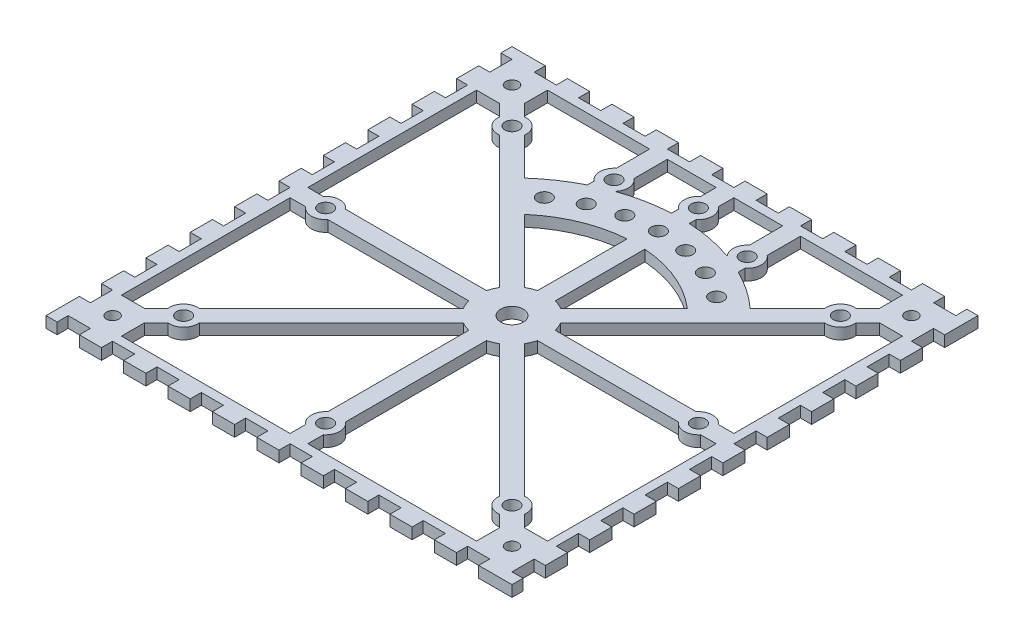
from build123d import *

# Parameters (mm, degrees)
SKETCH1_R           = 2.55
SKETCH1_R_2         = 1.6
SKETCH1_R_3         = 1.4
BOSS_EXTRUDE1_DEPTH = 2.5


with BuildPart() as part:
    # Sketch1 → Boss-Extrude1 (new body)
    with BuildSketch(Plane(origin=(0, 0, 0), x_dir=(1, 0, 0), z_dir=(0, 1, 0))):
        Polygon((-50, 52.5), (-45, 52.5), (-45, 50), (-40, 50), (-40, 52.5), (-35, 52.5), (-35, 50), (-30, 50), (-30, 52.5), (-25, 52.5), (-25, 50), (-20, 50), (-20, 52.5), (-15, 52.5), (-15, 50), (-10, 50), (-10, 52.5), (-5, 52.5), (-5, 50), (0, 50), (0, 52.5), (5, 52.5), (5, 50), (10, 50), (10, 52.5), (15, 52.5), (15, 50), (20, 50), (20, 52.5), (25, 52.5), (25, 50), (30, 50), (30, 52.5), (35, 52.5), (35, 50), (40, 50), (40, 52.5), (45, 52.5), (45, 50), (50, 50), (50, 52.5), (52.5, 52.5), (52.5, 50), (52.5, 45), (50, 45), (50, 40), (52.5, 40), (52.5, 35), (50, 35), (50, 30), (52.5, 30), (52.5, 25), (50, 25), (50, 20), (52.5, 20), (52.5, 15), (50, 15), (50, 10), (52.5, 10), (52.5, 5), (50, 5), (50, 0), (52.5, 0), (52.5, -5), (50, -5), (50, -10), (52.5, -10), (52.5, -15), (50, -15), (50, -20), (52.5, -20), (52.5, -25), (50, -25), (50, -30), (52.5, -30), (52.5, -35), (50, -35), (50, -40), (52.5, -40), (52.5, -45), (50, -45), (50, -50), (52.5, -50), (52.5, -52.5), (50, -52.5), (45, -52.5), (45, -50), (40, -50), (40, -52.5), (35, -52.5), (35, -50), (30, -50), (30, -52.5), (25, -52.5), (25, -50), (20, -50), (20, -52.5), (15, -52.5), (15, -50), (10, -50), (10, -52.5), (5, -52.5), (5, -50), (0, -50), (0, -52.5), (-5, -52.5), (-5, -50), (-10, -50), (-10, -52.5), (-15, -52.5), (-15, -50), (-20, -50), (-20, -52.5), (-25, -52.5), (-25, -50), (-30, -50), (-30, -52.5), (-35, -52.5), (-35, -50), (-40, -50), (-40, -52.5), (-45, -52.5), (-45, -50), (-50, -50), (-50, -52.5), (-52.5, -52.5), (-52.5, -50), (-52.5, -45), (-50, -45), (-50, -40), (-52.5, -40), (-52.5, -35), (-50, -35), (-50, -30), (-52.5, -30), (-52.5, -25), (-50, -25), (-50, -20), (-52.5, -20), (-52.5, -15), (-50, -15), (-50, -10), (-52.5, -10), (-52.5, -5), (-50, -5), (-50, 0), (-52.5, 0), (-52.5, 5), (-50, 5), (-50, 10), (-52.5, 10), (-52.5, 15), (-50, 15), (-50, 20), (-52.5, 20), (-52.5, 25), (-50, 25), (-50, 30), (-52.5, 30), (-52.5, 35), (-50, 35), (-50, 40), (-52.5, 40), (-52.5, 45), (-50, 45), (-50, 50), (-52.5, 50), (-52.5, 52.5), align=None)
        Circle(SKETCH1_R, mode=Mode.SUBTRACT)
        with Locations((37, -37)):
            Circle(SKETCH1_R_2, mode=Mode.SUBTRACT)
        with Locations((-37, -37)):
            Circle(SKETCH1_R_2, mode=Mode.SUBTRACT)
        with Locations((-37, 37)):
            Circle(SKETCH1_R_2, mode=Mode.SUBTRACT)
        with Locations((37, 37)):
            Circle(SKETCH1_R_2, mode=Mode.SUBTRACT)
        with Locations((0, 42)):
            Circle(SKETCH1_R_2, mode=Mode.SUBTRACT)
        with Locations((42, 0)):
            Circle(SKETCH1_R_2, mode=Mode.SUBTRACT)
        with Locations((-42, 0)):
            Circle(SKETCH1_R_2, mode=Mode.SUBTRACT)
        with Locations((0, -42)):
            Circle(SKETCH1_R_2, mode=Mode.SUBTRACT)
        with Locations((-45, 45)):
            Circle(SKETCH1_R_3, mode=Mode.SUBTRACT)
        with Locations((45, 45)):
            Circle(SKETCH1_R_3, mode=Mode.SUBTRACT)
        with Locations((-45, -45)):
            Circle(SKETCH1_R_3, mode=Mode.SUBTRACT)
        with Locations((45, -45)):
            Circle(SKETCH1_R_3, mode=Mode.SUBTRACT)
        with Locations((-15, 38)):
            Circle(SKETCH1_R_2, mode=Mode.SUBTRACT)
        with Locations((15, 38)):
            Circle(SKETCH1_R_2, mode=Mode.SUBTRACT)
        with Locations((0, 33)):
            Circle(SKETCH1_R_2, mode=Mode.SUBTRACT)
        with Locations((6.861085797, 32.278870824)):
            Circle(SKETCH1_R_2, mode=Mode.SUBTRACT)
        with Locations((13.422309222, 30.147000102)):
            Circle(SKETCH1_R_2, mode=Mode.SUBTRACT)
        with Locations((19.396913326, 26.697560814)):
            Circle(SKETCH1_R_2, mode=Mode.SUBTRACT)
        with Locations((-19.396913326, 26.697560814)):
            Circle(SKETCH1_R_2, mode=Mode.SUBTRACT)
        with Locations((-13.422309221, 30.147000102)):
            Circle(SKETCH1_R_2, mode=Mode.SUBTRACT)
        with Locations((-6.861085797, 32.278870824)):
            Circle(SKETCH1_R_2, mode=Mode.SUBTRACT)
        with BuildLine():
            Line((-40, 48), (-17, 48))
            Line((-17, 48), (-17, 40.497999199))
            ThreePointArc((-17, 40.497999199), (-18.2, 38), (-17, 35.502000801))
            Line((-17, 35.502000801), (-17, 33.985290936))
            ThreePointArc((-17, 33.985290936), (-21.402484999, 31.399580186), (-25.418602168, 28.247029292))
            Line((-25.418602168, 28.247029292), (-33.819434264, 36.647861389))
            ThreePointArc((-33.819434264, 36.647861389), (-34.7372583, 39.2627417), (-37.352138611, 40.180565736))
            Line((-37.352138611, 40.180565736), (-40, 42.828427125))
            Line((-40, 42.828427125), (-40, 48))
        make_face(mode=Mode.SUBTRACT)
        with BuildLine():
            Line((-48, 40), (-48, 2))
            Line((-48, 2), (-44.497999199, 2))
            ThreePointArc((-44.497999199, 2), (-42, 3.2), (-39.502000801, 2))
            Line((-39.502000801, 2), (-7.745966692, 2))
            ThreePointArc((-7.745966692, 2), (-7.39103626, 3.061467459), (-6.891439137, 4.063012013))
            Line((-6.891439137, 4.063012013), (-36.647861389, 33.819434264))
            ThreePointArc((-36.647861389, 33.819434264), (-39.2627417, 34.7372583), (-40.180565736, 37.352138611))
            Line((-40.180565736, 37.352138611), (-42.828427125, 40))
            Line((-42.828427125, 40), (-48, 40))
        make_face(mode=Mode.SUBTRACT)
        with BuildLine():
            Line((-40, -48), (-2, -48))
            Line((-2, -48), (-2, -44.497999199))
            ThreePointArc((-2, -44.497999199), (-3.2, -42), (-2, -39.502000801))
            Line((-2, -39.502000801), (-2, -7.745966692))
            ThreePointArc((-2, -7.745966692), (-3.061467459, -7.39103626), (-4.063012013, -6.891439137))
            Line((-4.063012013, -6.891439137), (-33.819434264, -36.647861389))
            ThreePointArc((-33.819434264, -36.647861389), (-34.7372583, -39.2627417), (-37.352138611, -40.180565736))
            Line((-37.352138611, -40.180565736), (-40, -42.828427125))
            Line((-40, -42.828427125), (-40, -48))
        make_face(mode=Mode.SUBTRACT)
        with BuildLine():
            Line((48, 40), (48, 2))
            Line((48, 2), (44.497999199, 2))
            ThreePointArc((44.497999199, 2), (42, 3.2), (39.502000801, 2))
            Line((39.502000801, 2), (7.745966692, 2))
            ThreePointArc((7.745966692, 2), (7.39103626, 3.061467459), (6.891439137, 4.063012013))
            Line((6.891439137, 4.063012013), (36.647861389, 33.819434264))
            ThreePointArc((36.647861389, 33.819434264), (39.2627417, 34.7372583), (40.180565736, 37.352138611))
            Line((40.180565736, 37.352138611), (42.828427125, 40))
            Line((42.828427125, 40), (48, 40))
        make_face(mode=Mode.SUBTRACT)
        with BuildLine():
            Line((48, -2), (48, -40))
            Line((48, -40), (42.828427125, -40))
            Line((42.828427125, -40), (40.180565736, -37.352138611))
            ThreePointArc((40.180565736, -37.352138611), (39.2627417, -34.7372583), (36.647861389, -33.819434264))
            Line((36.647861389, -33.819434264), (6.891439137, -4.063012013))
            ThreePointArc((6.891439137, -4.063012013), (7.39103626, -3.061467459), (7.745966692, -2))
            Line((7.745966692, -2), (39.502000801, -2))
            ThreePointArc((39.502000801, -2), (42, -3.2), (44.497999199, -2))
            Line((44.497999199, -2), (48, -2))
        make_face(mode=Mode.SUBTRACT)
        with BuildLine():
            Line((40, -42.828427125), (37.352138611, -40.180565736))
            ThreePointArc((37.352138611, -40.180565736), (34.7372583, -39.2627417), (33.819434264, -36.647861389))
            Line((33.819434264, -36.647861389), (4.063012013, -6.891439137))
            ThreePointArc((4.063012013, -6.891439137), (3.061467459, -7.39103626), (2, -7.745966692))
            Line((2, -7.745966692), (2, -39.502000801))
            ThreePointArc((2, -39.502000801), (3.2, -42), (2, -44.497999199))
            Line((2, -44.497999199), (2, -48))
            Line((2, -48), (40, -48))
            Line((40, -48), (40, -42.828427125))
        make_face(mode=Mode.SUBTRACT)
        with BuildLine():
            Line((-48, -2), (-44.497999199, -2))
            ThreePointArc((-44.497999199, -2), (-42, -3.2), (-39.502000801, -2))
            Line((-39.502000801, -2), (-7.745966692, -2))
            ThreePointArc((-7.745966692, -2), (-7.39103626, -3.061467459), (-6.891439137, -4.063012013))
            Line((-6.891439137, -4.063012013), (-36.647861389, -33.819434264))
            ThreePointArc((-36.647861389, -33.819434264), (-39.2627417, -34.7372583), (-40.180565736, -37.352138611))
            Line((-40.180565736, -37.352138611), (-42.828427125, -40))
            Line((-42.828427125, -40), (-48, -40))
            Line((-48, -40), (-48, -2))
        make_face(mode=Mode.SUBTRACT)
        with BuildLine():
            Line((2, 48), (2, 44.497999199))
            ThreePointArc((2, 44.497999199), (3.2, 42), (2, 39.502000801))
            Line((2, 39.502000801), (2, 37.947331922))
            ThreePointArc((2, 37.947331922), (7.397643577, 37.272977739), (12.643700473, 35.834855076))
            ThreePointArc((12.643700473, 35.834855076), (11.809300285, 38.243793623), (13, 40.497999199))
            Line((13, 40.497999199), (13, 48))
            Line((13, 48), (2, 48))
        make_face(mode=Mode.SUBTRACT)
        with BuildLine():
            Line((-2, 39.502000801), (-2, 37.947331922))
            ThreePointArc((-2, 37.947331922), (-7.397643577, 37.272977739), (-12.643700473, 35.834855076))
            ThreePointArc((-12.643700473, 35.834855076), (-11.809300285, 38.243793623), (-13, 40.497999199))
            Line((-13, 40.497999199), (-13, 48))
            Line((-13, 48), (-2, 48))
            Line((-2, 48), (-2, 44.497999199))
            ThreePointArc((-2, 44.497999199), (-3.2, 42), (-2, 39.502000801))
        make_face(mode=Mode.SUBTRACT)
        with BuildLine():
            Line((33.819434264, 36.647861389), (25.418602168, 28.247029292))
            ThreePointArc((25.418602168, 28.247029292), (21.402484999, 31.399580186), (17, 33.985290936))
            Line((17, 33.985290936), (17, 35.502000801))
            ThreePointArc((17, 35.502000801), (18.2, 38), (17, 40.497999199))
            Line((17, 40.497999199), (17, 48))
            Line((17, 48), (40, 48))
            Line((40, 48), (40, 42.828427125))
            Line((40, 42.828427125), (37.352138611, 40.180565736))
            ThreePointArc((37.352138611, 40.180565736), (34.7372583, 39.2627417), (33.819434264, 36.647861389))
        make_face(mode=Mode.SUBTRACT)
        with BuildLine():
            Line((-18.334204096, 21.162631221), (-4.063012013, 6.891439137))
            ThreePointArc((-4.063012013, 6.891439137), (-3.061467459, 7.39103626), (-2, 7.745966692))
            Line((-2, 7.745966692), (-2, 27.928480088))
            ThreePointArc((-2, 27.928480088), (-10.715136106, 25.86862691), (-18.334204096, 21.162631221))
        make_face(mode=Mode.SUBTRACT)
        with BuildLine():
            Line((18.334204096, 21.16263122), (4.063012013, 6.891439137))
            ThreePointArc((4.063012013, 6.891439137), (3.061467459, 7.39103626), (2, 7.745966692))
            Line((2, 7.745966692), (2, 27.928480088))
            ThreePointArc((2, 27.928480088), (10.715136106, 25.86862691), (18.334204096, 21.16263122))
        make_face(mode=Mode.SUBTRACT)
    extrude(amount=BOSS_EXTRUDE1_DEPTH)


solid = part.part
